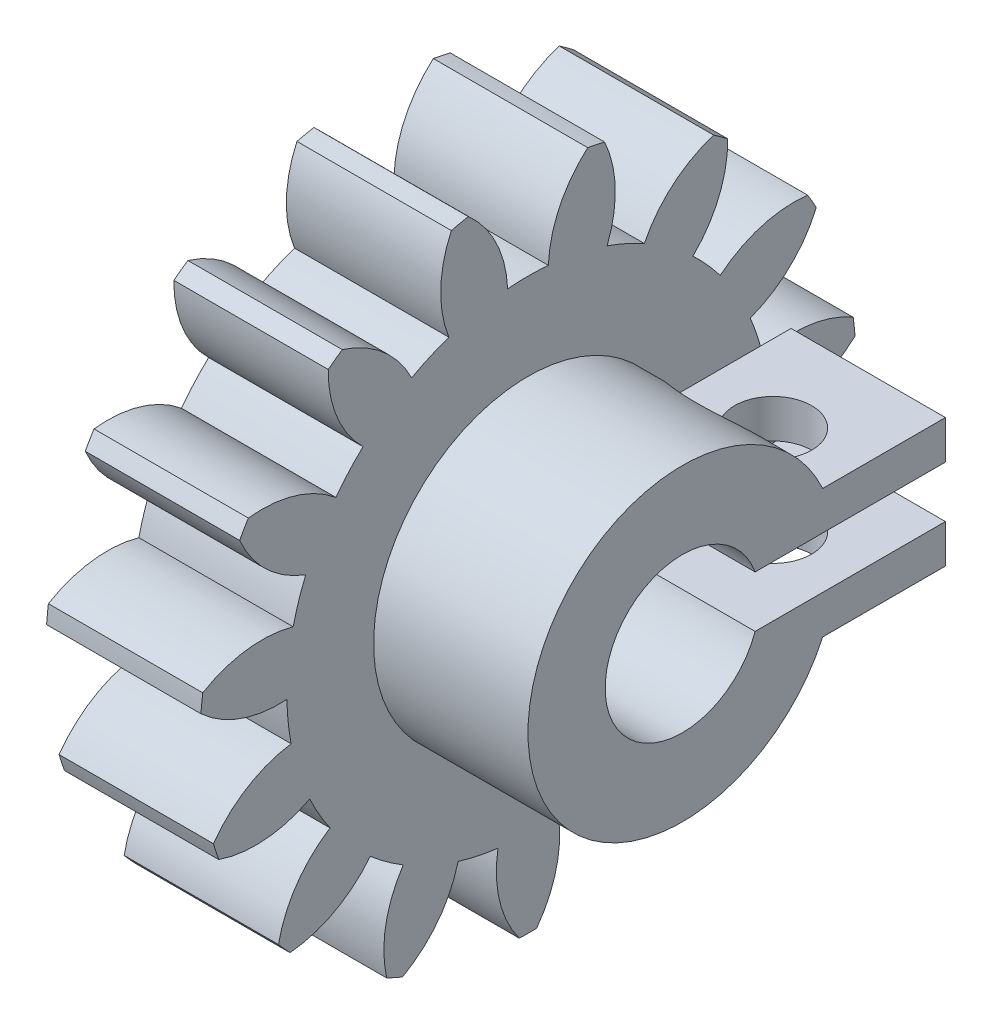
from build123d import *

# Parameters (mm, degrees)
BASPROSKE_W             = 6
BASPROSKE_H             = 12.75
TOOTHCUT_DEPTH          = 20.003289189
TEETHCUTS_COUNT         = 15
TEETHCUTS_ANGLE         = 336
BORSKE_R                = 3
BORE_DEPTH              = 50.0000508
BOSS_EXTRUDE2_START     = 6
SKETCH1_R               = 6
SKETCH1_R_2             = 3
BOSS_EXTRUDE2_DEPTH     = 6
CUT_EXTRUDE1_START      = -6.0000001
CUT_EXTRUDE1_OUTLINE_W  = 6
CUT_EXTRUDE1_OUTLINE_H  = 2
CUT_EXTRUDE1_DEPTH      = 3.171572975
SKETCH3_W               = 6
SKETCH3_H               = 7.395975174
BOSS_EXTRUDE3_DEPTH     = 1.5
BOSS_EXTRUDE4_DEPTH     = 1.5
CUT_EXTRUDE2_DEPTH      = 23.109303185
CUT_EXTRUDE2_DEPTH_BACK = 23.109303185
SKETCH6_R               = 1.5
CUT_EXTRUDE3_DEPTH      = 24.197646745


# Read off the part's stored shape, not the designer's step: Cut-Extrude1
with BuildPart() as part:
    # BasProSke → Base-Revolve (revolve)
    with BuildSketch(Plane(origin=(0, 0, 0), x_dir=(1, 0, 0), z_dir=(0, 1, 0)), mode=Mode.PRIVATE) as base_revolve_sk:
        with Locations((3, 6.375)):
            Rectangle(BASPROSKE_W, BASPROSKE_H)
    revolve(base_revolve_sk.sketch.rotate(Axis((-10, 0, 0), (1, 0, 0)), 180), axis=Axis((-10, 0, 0), (1, 0, 0)))

    # TooCutSke → ToothCut (cut, through all)
    with BuildSketch(Plane(origin=(0, 0, 0), x_dir=(0, 0, -1), z_dir=(1, 0, 0))):
        with BuildLine():
            ThreePointArc((0.791546546, 9.340520867), (0, 9.374), (-0.791546546, 9.340520867))
            ThreePointArc((-0.791546546, 9.340520867), (-1.235070734, 11.110218102), (-2.344732916, 12.558386549))
            ThreePointArc((-2.344732916, 12.558386549), (0, 12.7754), (2.344732916, 12.558386549))
            ThreePointArc((2.344732916, 12.558386549), (1.235070734, 11.110218102), (0.791546546, 9.340520867))
        make_face()
    toothcut = extrude(amount=TOOTHCUT_DEPTH, mode=Mode.SUBTRACT)

    # TeethCuts: ToothCut ×15 about axis
    teethcuts_axis = Axis((-10, 0, 0), (1, 0, 0))
    for i in range(1, TEETHCUTS_COUNT):
        add(toothcut.rotate(teethcuts_axis, i * TEETHCUTS_ANGLE / (TEETHCUTS_COUNT - 1)), mode=Mode.SUBTRACT)

    # BorSke → Bore (cut, symmetric)
    with BuildSketch(Plane(origin=(0, 0, 0), x_dir=(0, 0, -1), z_dir=(1, 0, 0))):
        with Locations(Location((0, 0, 0), (0, 0, 180))):
            Circle(BORSKE_R)
    extrude(amount=BORE_DEPTH, both=True, mode=Mode.SUBTRACT)

    # Sketch1 → Boss-Extrude2 (add)
    with BuildSketch(Plane(origin=(6, 0, 0), x_dir=(0, 0, -1), z_dir=(1, 0, 0)).offset(BOSS_EXTRUDE2_START)):
        with Locations(Location((0, 0, 0), (0, 0, 180))):
            Circle(SKETCH1_R)
        Circle(SKETCH1_R_2, mode=Mode.SUBTRACT)
    extrude(amount=-BOSS_EXTRUDE2_DEPTH)

    # Cut-Extrude1 outline → Cut-Extrude1 (cut)
    with BuildSketch(Plane.XY.offset(CUT_EXTRUDE1_START)):
        with Locations((9, 0)):
            Rectangle(CUT_EXTRUDE1_OUTLINE_W, CUT_EXTRUDE1_OUTLINE_H)
    extrude(amount=CUT_EXTRUDE1_DEPTH, mode=Mode.SUBTRACT)

    # Sketch3 → Boss-Extrude3 (add)
    with BuildSketch(Plane(origin=(0, -1, 0), x_dir=(1, 0, 0), z_dir=(0, 1, 0))):
        with Locations((9, 6.526414712)):
            Rectangle(SKETCH3_W, SKETCH3_H)
    extrude(amount=-BOSS_EXTRUDE3_DEPTH)

    # Sketch5 → Boss-Extrude4 (add)
    with BuildSketch(Plane.XZ.offset(-1)):
        Polygon((6, -10.224402299), (6, -9.320508355), (6, -2.828427125), (12, -2.828427125), (12, -10.224402299), align=None)
    extrude(amount=-BOSS_EXTRUDE4_DEPTH)

    # Sketch6 → Cut-Extrude2 (cut, two sides: drawn at the far end of the back side and taken through both)
    with BuildSketch(Plane(origin=(0, -1, 0), x_dir=(1, 0, 0), z_dir=(0, 1, 0)).offset(-CUT_EXTRUDE2_DEPTH_BACK)):
        with Locations(Location((9, 6.526414712, 0), (0, 0, 270))):
            Circle(SKETCH6_R)
    extrude(amount=CUT_EXTRUDE2_DEPTH + CUT_EXTRUDE2_DEPTH_BACK, mode=Mode.SUBTRACT)

    # Sketch7 → Cut-Extrude3 (cut, through all)
    with BuildSketch(Plane(origin=(0, 2.5, 0), x_dir=(1, 0, 0), z_dir=(0, 1, 0))):
        with BuildLine():
            ThreePointArc((6.901724288, 4.382297403), (9, 3.526414712), (11.098275712, 4.382297403))
            ThreePointArc((11.098275712, 4.382297403), (9, 9.526414712), (6.901724288, 4.382297403))
        make_face()
    extrude(amount=CUT_EXTRUDE3_DEPTH, mode=Mode.SUBTRACT)


solid = part.part
